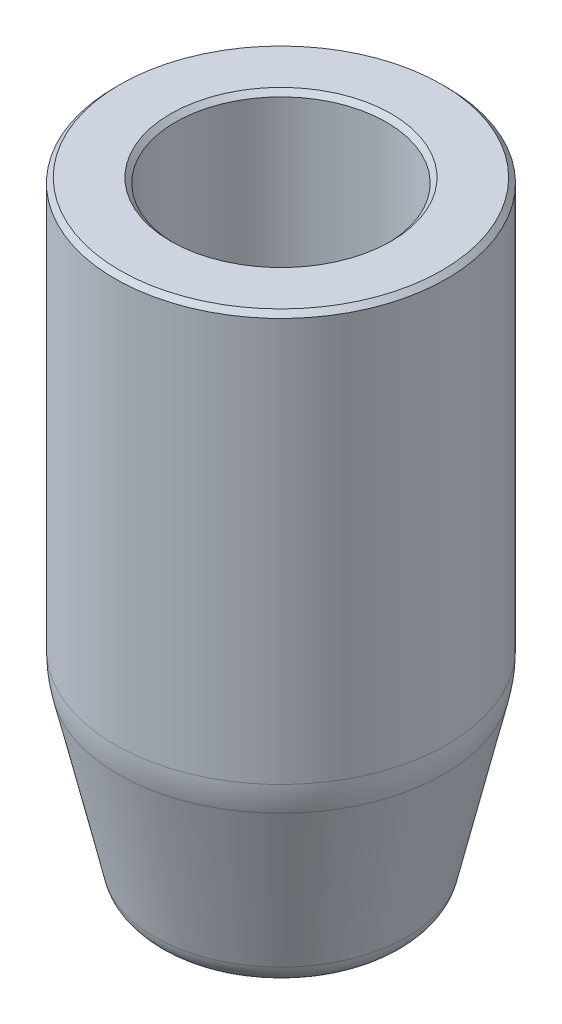
from build123d import *

# Parameters (mm, degrees)
FILLET2_R     = 6.35
FILLET3_R     = 1.5875
FILLET1_R     = 0.79375
CHAMFER1_SIZE = 0.254


with BuildPart() as part:
    # Sketch1 → Revolve1 (revolve)
    with BuildSketch(Plane.XY):
        Polygon((8.73125, 32.54375), (5.55625, 32.54375), (5.55625, 10.31875), (3.96875, 10.31875), (3.96875, 3.175), (2.38125, 3.175), (2.38125, 0), (6.35, 0), (8.73125, 10.31875), align=None)
    revolve(axis=Axis((0, 4.297998533, 0), (0, -1, 0)))

    # Fillet2
    fillet2_edges = [part.edges().sort_by_distance(p)[0] for p in [
        (-8.73125, 10.31875, 0),
    ]]
    fillet(fillet2_edges, radius=FILLET2_R)

    # Fillet3
    fillet3_edges = [part.edges().sort_by_distance(p)[0] for p in [
        (-6.35, 0, 0),
    ]]
    fillet(fillet3_edges, radius=FILLET3_R)

    # Fillet1
    fillet1_edges = [part.edges().sort_by_distance(p)[0] for p in [
        (-5.55625, 10.31875, 0),
        (-3.96875, 3.175, 0),
    ]]
    fillet(fillet1_edges, radius=FILLET1_R)

    # Chamfer1
    chamfer1_edges = [part.edges().sort_by_distance(p)[0] for p in [
        (-2.38125, 3.175, 0),
        (-2.38125, 0, 0),
        (-8.73125, 32.54375, 0),
        (-5.55625, 32.54375, 0),
        (-3.96875, 10.31875, 0),
    ]]
    chamfer(chamfer1_edges, length=CHAMFER1_SIZE)


solid = part.part
